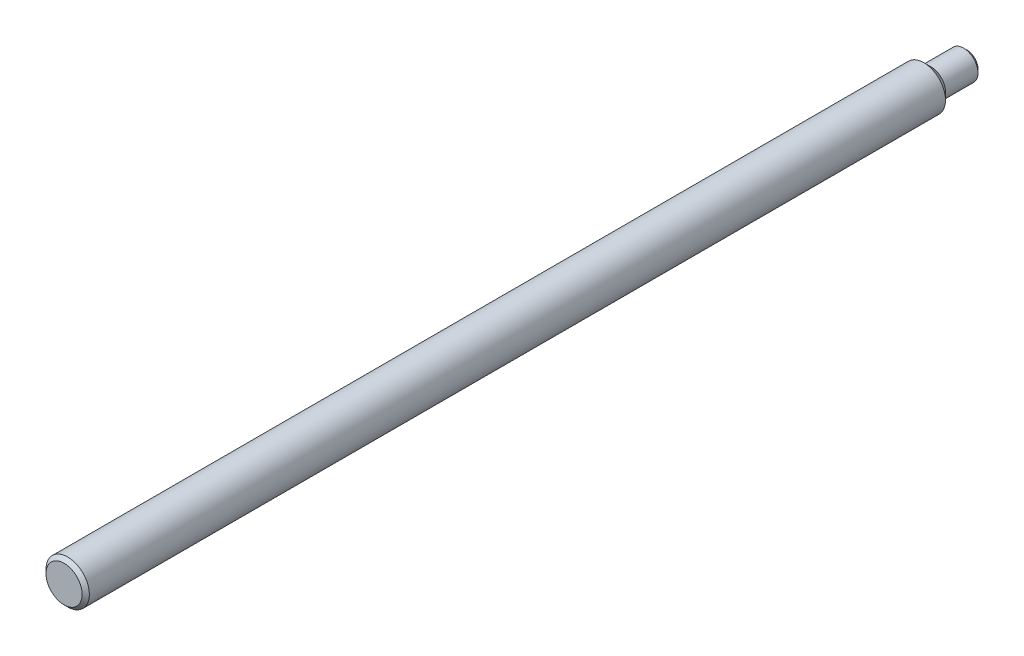
from build123d import *

# Parameters (mm, degrees)
SCHIZZO1_R                   = 6
ESTRUSIONE_ESTRUSIONE1_DEPTH = 250
SMUSSO1_SIZE                 = 1


with BuildPart() as part:
    # Schizzo1 → Estrusione-Estrusione1 (new body)
    with BuildSketch(Plane.XY):
        Circle(SCHIZZO1_R)
    extrude(amount=ESTRUSIONE_ESTRUSIONE1_DEPTH)

    # Schizzo2 → Taglia-Rivoluzione1 (revolve, cut)
    with BuildSketch(Plane(origin=(0, 0, 0), x_dir=(1, 0, 0), z_dir=(0, 1, 0))):
        Polygon((-4, -10), (-6, -12), (-6, 0), (-4, 0), align=None)
    revolve(axis=Axis((0, 0, -1.898721367), (0, 0, 1)), mode=Mode.SUBTRACT)

    # Smusso1
    smusso1_edges = [part.edges().sort_by_distance(p)[0] for p in [
        (4, 0, 0),
        (-6, 0, 250),
    ]]
    chamfer(smusso1_edges, length=SMUSSO1_SIZE)


solid = part.part
